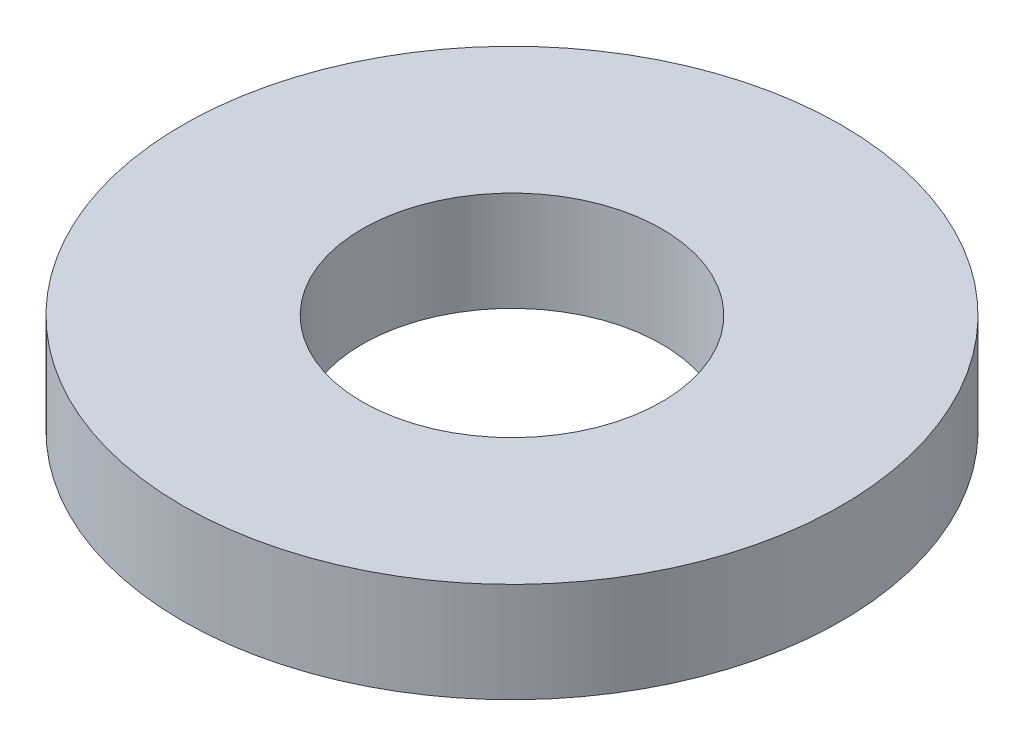
from build123d import *

# Parameters (mm, degrees)
SKETCH1_R           = 82.5
BOSS_EXTRUDE1_DEPTH = 25
SKETCH2_R           = 37.5
CUT_EXTRUDE1_DEPTH  = 120.320995638


with BuildPart() as part:
    # Sketch1 → Boss-Extrude1 (new body)
    with BuildSketch(Plane(origin=(0, 0, 0), x_dir=(1, 0, 0), z_dir=(0, 1, 0))):
        Circle(SKETCH1_R)
    extrude(amount=BOSS_EXTRUDE1_DEPTH)

    # Sketch2 → Cut-Extrude1 (cut, through all)
    with BuildSketch(Plane(origin=(0, 0, 0), x_dir=(1, 0, 0), z_dir=(0, 1, 0))):
        Circle(SKETCH2_R)
    extrude(amount=CUT_EXTRUDE1_DEPTH, mode=Mode.SUBTRACT)


solid = part.part
